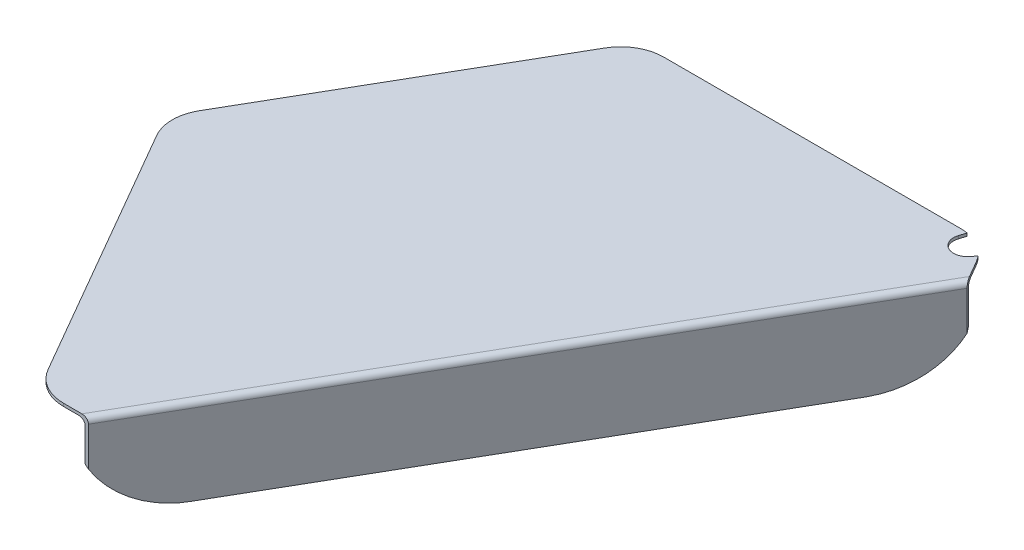
from build123d import *

# Parameters (mm, degrees)
SALIENTE_EXTRUIR1_DEPTH = 1
SALIENTE_EXTRUIR2_DEPTH = 31
REDONDEO1_R             = 2
CORTAR_EXTRUIR1_DEPTH   = 2


with BuildPart() as part:
    # Croquis1 → Saliente-Extruir1 (new body)
    with BuildSketch(Plane(origin=(0, 0, 0), x_dir=(1, 0, 0), z_dir=(0, 1, 0))):
        with BuildLine():
            Line((-115.079714212, -8.823380035), (-63.118189984, -98.823380035))
            ThreePointArc((-63.118189984, -98.823380035), (-57.627808928, -104.313761092), (-50.127808928, -106.323380035))
            Line((-50.127808928, -106.323380035), (-41.46755489, -106.323380035))
            Line((-41.46755489, -106.323380035), (71.115747602, 88.676619965))
            Line((71.115747602, 88.676619965), (66.785620583, 96.176619965))
            ThreePointArc((66.785620583, 96.176619965), (66.063002538, 97.308073533), (65.242113494, 98.370384784))
            Line((65.242113494, 98.370384784), (65.20832792, 98.329502389))
            Line((65.20832792, 98.329502389), (63.931741209, 96.784762544))
            ThreePointArc((63.931741209, 96.784762544), (57.937576979, 95.44880576), (55.609284572, 101.131572674))
            Line((55.609284572, 101.131572674), (56.341107438, 103.402342517))
            Line((56.341107438, 103.402342517), (56.358401529, 103.456004274))
            ThreePointArc((56.358401529, 103.456004274), (55.08155896, 103.621364269), (53.795239526, 103.676619965))
            Line((53.795239526, 103.676619965), (-50.127808928, 103.676619965))
            ThreePointArc((-50.127808928, 103.676619965), (-57.627808928, 101.667001022), (-63.118189984, 96.176619965))
            Line((-63.118189984, 96.176619965), (-115.079714212, 6.176619965))
            ThreePointArc((-115.079714212, 6.176619965), (-117.089333155, -1.323380035), (-115.079714212, -8.823380035))
        make_face()
    extrude(amount=SALIENTE_EXTRUIR1_DEPTH)

    # Croquis2 → Saliente-Extruir2 (add)
    with BuildSketch(Plane.XZ):
        Polygon((70.538397333, -89.676619965), (71.115747602, -88.676619965), (-41.46755489, 106.323380035), (-42.622255428, 106.323380035), align=None)
    extrude(amount=SALIENTE_EXTRUIR2_DEPTH)

    # Redondeo1
    redondeo1_edges = [part.edges().sort_by_distance(p)[0] for p in [
        (14.824096356, 1, 8.823380035),
        (13.958070952, 0, 8.323380035),
    ]]
    fillet(redondeo1_edges, radius=REDONDEO1_R)

    # Croquis3 → Cortar-Extruir1 (cut)
    with BuildSketch(Plane(origin=(14.938707896, 0, 8.624867025), x_dir=(0.49999999999999983, 0, -0.8660254037844387), z_dir=(0.8660254037844387, 0, 0.49999999999999983))):
        with BuildLine():
            add(Edge.make_bspline(
                [(-117.14265259, 0.8), (-117.14265259, -29.2), (-86.831763458, -29.2)],
                knots=[3.141592654, 3.141592654, 3.141592654, 4.71238898, 4.71238898, 4.71238898], degree=2, weights=[1, 0.707106781, 1]))
            Line((-117.14265259, 0.8), (-128.509159891, -12.943048078))
            Line((-128.509159891, -12.943048078), (-113.226187721, -43.828381759))
            Line((-113.226187721, -43.828381759), (121.292947467, -43.828381759))
            Line((121.292947467, -43.828381759), (140.229409901, -2.708549898))
            Line((140.229409901, -2.708549898), (116.684206431, 0.8))
            add(Edge.make_bspline(
                [(86.373317299, -29.2), (116.684206431, -29.2), (116.684206431, 0.8)],
                knots=[1.570796327, 1.570796327, 1.570796327, 3.141592654, 3.141592654, 3.141592654], degree=2, weights=[1, 0.707106781, 1]))
            Line((86.373317299, -29.2), (78.379595664, -29.2))
            Line((78.379595664, -29.2), (77.62883909, -29.2))
            Line((77.62883909, -29.2), (43.07204711, -29.2))
            Line((43.07204711, -29.2), (-43.530493269, -29.2))
            Line((-43.530493269, -29.2), (-78.045576665, -29.2))
            Line((-78.045576665, -29.2), (-78.79593106, -29.2))
            Line((-78.79593106, -29.2), (-86.831763458, -29.2))
        make_face()
    extrude(amount=-CORTAR_EXTRUIR1_DEPTH, mode=Mode.SUBTRACT)


solid = part.part
